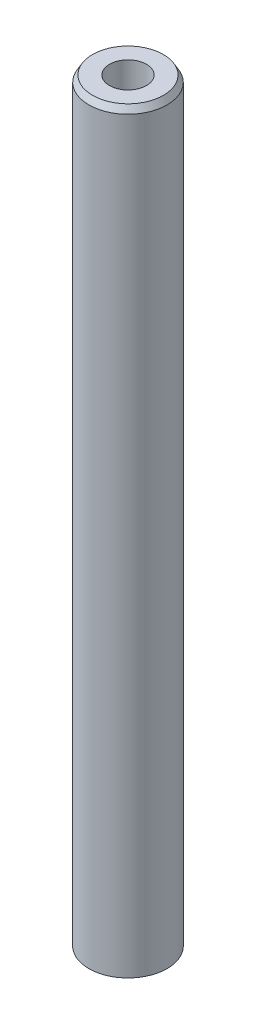
from build123d import *
from OCP.BRepFilletAPI import BRepFilletAPI_MakeChamfer

# Parameters (mm, degrees)
SKETCH1_R           = 5
BOSS_EXTRUDE1_DEPTH = 96.889155405
SKETCH2_R           = 2.362758692
CUT_EXTRUDE1_DEPTH  = 98.146839553
CHAMFER1_SIZE       = 0.820729918
CHAMFER1_SIZE2      = 0.473848639


with BuildPart() as part:
    # Sketch1 → Boss-Extrude1 (new body)
    with BuildSketch(Plane(origin=(0, 0, 0), x_dir=(1, 0, 0), z_dir=(0, 1, 0))):
        Circle(SKETCH1_R)
    extrude(amount=BOSS_EXTRUDE1_DEPTH)

    # Sketch2 → Cut-Extrude1 (cut, through all)
    with BuildSketch(Plane(origin=(0, 0, 0), x_dir=(1, 0, 0), z_dir=(0, 1, 0))):
        Circle(SKETCH2_R)
    extrude(amount=CUT_EXTRUDE1_DEPTH, mode=Mode.SUBTRACT)

    # Chamfer1: one chamfer whose edges measure the first distance from different faces: ONE call of the kernel's chamfer builder (chamfer() names one face for all edges)
    chamfer1_edges_1 = [part.edges().sort_by_distance(p)[0] for p in [
        (-5, 96.889155405, 0),
    ]]
    chamfer1_side_1 = [part.faces().sort_by_distance(p)[0] for p in [
        (-5, 48.444577703, 0),
    ]]
    chamfer1_edges_2 = [part.edges().sort_by_distance(p)[0] for p in [
        (-5, 0, 0),
    ]]
    chamfer1_side_2 = [part.faces().sort_by_distance(p)[0] for p in [
        (-4.858578644, 0, 0),
    ]]
    chamfer1 = BRepFilletAPI_MakeChamfer(part.part.solid().wrapped)
    for e in chamfer1_edges_1:
        chamfer1.Add(CHAMFER1_SIZE, CHAMFER1_SIZE2, e.wrapped, chamfer1_side_1[0].wrapped)  # the first distance lies on this face
    for e in chamfer1_edges_2:
        chamfer1.Add(CHAMFER1_SIZE, CHAMFER1_SIZE2, e.wrapped, chamfer1_side_2[0].wrapped)  # the first distance lies on this face
    add(Compound.cast(chamfer1.Shape()), mode=Mode.REPLACE)


solid = part.part
